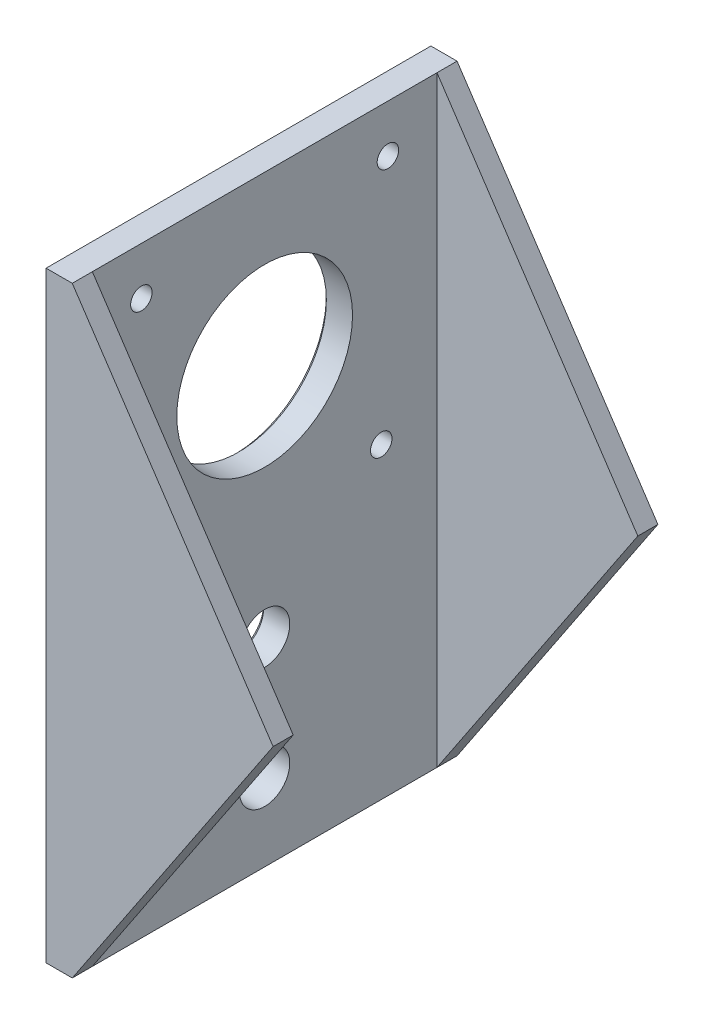
from build123d import *

# Parameters (mm, degrees)
SKETCH1_R           = 11.1125
SKETCH1_R_2         = 1.3589
SKETCH1_R_3         = 3.175
BOSS_EXTRUDE1_DEPTH = 3.81
BOSS_EXTRUDE2_DEPTH = 2.54
CHAMFER1_SIZE       = 0.5


with BuildPart() as part:
    # Sketch1 → Boss-Extrude1 (new body)
    with BuildSketch(Plane(origin=(0, 0, 0), x_dir=(0, 0, -1), z_dir=(1, 0, 0))):
        Polygon((21.79, -21.209), (21.79, -54.874917619), (-21.79, -54.874917619), (-21.79, -21.209), (-21.79, 21.209), (21.79, 21.209), align=None)
        Circle(SKETCH1_R, mode=Mode.SUBTRACT)
        with Locations((15.588824177, 15.173169893)):
            Circle(SKETCH1_R_2, mode=Mode.SUBTRACT)
        with Locations((-15.588824177, 15.173169893)):
            Circle(SKETCH1_R_2, mode=Mode.SUBTRACT)
        with Locations((-14.746436813, -15.993096172)):
            Circle(SKETCH1_R_2, mode=Mode.SUBTRACT)
        with Locations((14.746436813, -15.993096172)):
            Circle(SKETCH1_R_2, mode=Mode.SUBTRACT)
        with Locations((0, -29.845)):
            Circle(SKETCH1_R_3, mode=Mode.SUBTRACT)
        with Locations((0, -45.085)):
            Circle(SKETCH1_R_3, mode=Mode.SUBTRACT)
    extrude(amount=BOSS_EXTRUDE1_DEPTH)

    # Sketch15 → Boss-Extrude2 (add)
    with BuildSketch(Plane.XY.offset(21.79)):
        Polygon((3.81, 21.209), (29.21, -16.832958809), (3.81, -54.874917619), (0, -54.874917619), (0, 21.209), align=None)
    boss_extrude2 = extrude(amount=BOSS_EXTRUDE2_DEPTH)

    # Mirror1: Boss-Extrude2 across plane
    add(boss_extrude2.mirror(Plane.XY))

    # Chamfer1
    chamfer1_edges = [part.edges().sort_by_distance(p)[0] for p in [
        (0, -45.085, 3.175),
        (0, -15.993096172, -13.387536813),
        (0, 15.173169893, 16.947724177),
        (0, 0, 11.1125),
        (0, -16.832958809, 24.33),
        (0, -54.874917619, 0),
        (0, -16.832958809, -24.33),
        (0, 21.209, 0),
        (0, 15.173169893, -14.229924177),
        (0, -15.993096172, 16.105336813),
        (0, -29.845, 3.175),
    ]]
    chamfer(chamfer1_edges, length=CHAMFER1_SIZE)


solid = part.part
